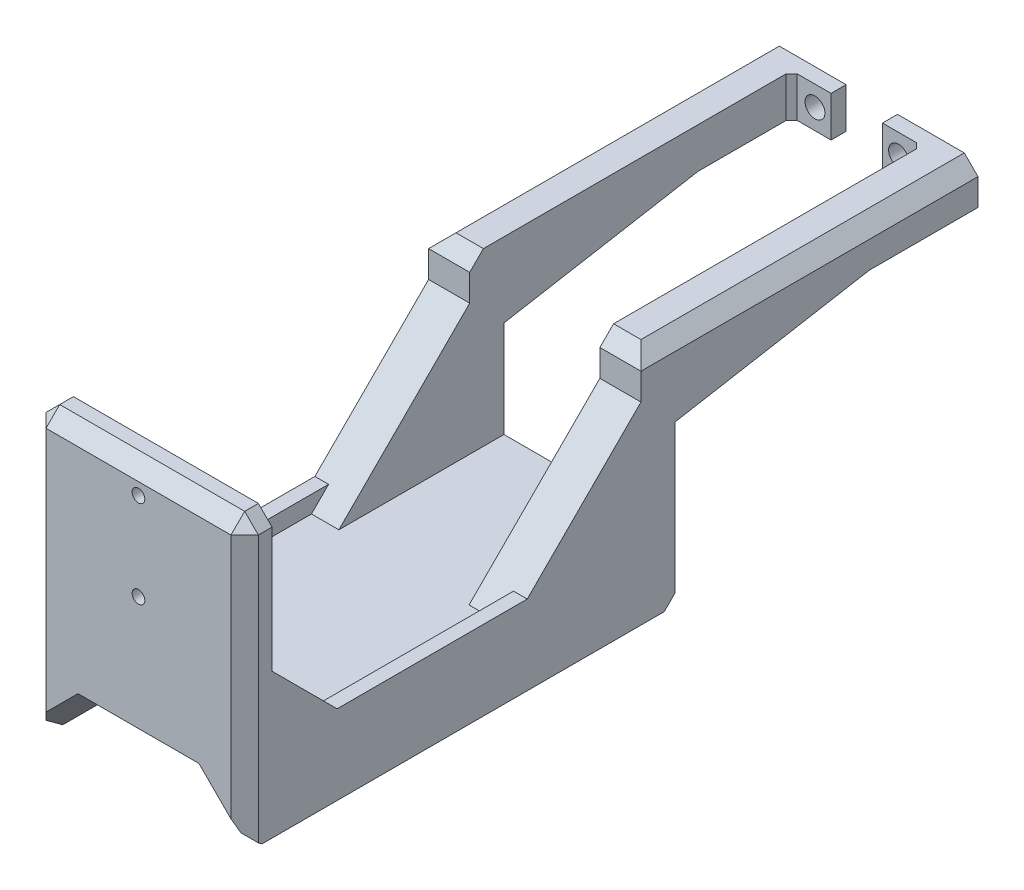
from build123d import *

# Parameters (mm, degrees)
SKETCH1_R             = 1.45
BOSS_EXTRUDE1_DEPTH   = 2.2
BOSS_EXTRUDE1_2_DEPTH = 2.2
SKETCH8_W             = 6
SKETCH8_H             = 5.9
BOSS_EXTRUDE6_DEPTH   = 42
BOSS_EXTRUDE7_DEPTH   = 5
SKETCH10_W            = 31
SKETCH10_H            = 3
BOSS_EXTRUDE8_DEPTH   = 53.85
SKETCH11_W            = 31
SKETCH11_H            = 35.214875224
SKETCH11_R            = 0.925
BOSS_EXTRUDE9_DEPTH   = 4
CHAMFER6_SIZE         = 19.1
CHAMFER7_SIZE         = 12
CHAMFER8_SIZE         = 2
CUT_EXTRUDE2_START    = 2
CUT_EXTRUDE2_DEPTH    = 27
CHAMFER10_SIZE        = 0.8
SKETCH14_W            = 7.5
SKETCH14_H            = 5.9
CUT_EXTRUDE3_DEPTH    = 112.547893301
CHAMFER11_SIZE        = 5
CHAMFER11_SIZE2       = 28.356409098
SKETCH15_W            = 2
SKETCH15_H            = 27.75
BOSS_EXTRUDE10_DEPTH  = 2.5
BOSS_EXTRUDE11_DEPTH  = 6.5
CHAMFER12_SIZE        = 1
CHAMFER13_SIZE        = 5.5
CHAMFER14_SIZE        = 1.464101615
CHAMFER14_SIZE_2      = 2
CHAMFER15_SIZE        = 0.4


# Some blends are built 0.0001 mm under size
with BuildPart() as part:
    # Sketch1 → Boss-Extrude1 (new body)
    with BuildSketch(Plane.XY):
        Polygon((0, 0), (0, 5.9), (12.25, 5.9), (12.25, 0), (2.5, 0), align=None)
        with Locations((9.4, 2.95)):
            Circle(SKETCH1_R, mode=Mode.SUBTRACT)
    extrude(amount=BOSS_EXTRUDE1_DEPTH)



with BuildPart() as body_2:
    # Sketch1 → Boss-Extrude1 2 (new body)
    with BuildSketch(Plane.XY):
        Polygon((31, 0), (31, 5.9), (18.75, 5.9), (18.75, 0), (28.5, 0), align=None)
        with Locations((21.6, 2.95)):
            Circle(SKETCH1_R, mode=Mode.SUBTRACT)
    extrude(amount=BOSS_EXTRUDE1_2_DEPTH)


with BuildPart() as part_1:
    add(part.part)

    add(body_2.part)  # Boss-Extrude6 merges body 2
    # Sketch8 → Boss-Extrude6 (add)
    with BuildSketch(Plane.XY.offset(2.2)):
        with Locations((3, 2.95)):
            Rectangle(SKETCH8_W, SKETCH8_H)
        with Locations((28, 2.95)):
            Rectangle(SKETCH8_W, SKETCH8_H)
    extrude(amount=BOSS_EXTRUDE6_DEPTH)

    # Sketch9 → Boss-Extrude7 (add)
    with BuildSketch(Plane.XY.offset(44.2)):
        Polygon((0, 5.9), (0, -22.1), (31, -22.1), (31, 5.9), (25, 5.9), (25, -19.1), (6, -19.1), (6, 5.9), align=None)
    extrude(amount=BOSS_EXTRUDE7_DEPTH)

    # Sketch10 → Boss-Extrude8 (add)
    with BuildSketch(Plane.XY.offset(49.2)):
        with Locations((15.5, -20.6)):
            Rectangle(SKETCH10_W, SKETCH10_H)
    extrude(amount=BOSS_EXTRUDE8_DEPTH)

    # Sketch11 → Boss-Extrude9 (add)
    with BuildSketch(Plane.XY.offset(103.05)):
        with Locations((15.5, -4.492562388)):
            Rectangle(SKETCH11_W, SKETCH11_H)
        with Locations((15.5, -3.45)):
            Circle(SKETCH11_R, mode=Mode.SUBTRACT)
        with Locations(Location((15.5, 9.35, 0), (0, 0, 180))):
            Circle(SKETCH11_R, mode=Mode.SUBTRACT)
    extrude(amount=BOSS_EXTRUDE9_DEPTH)

    # Chamfer6
    chamfer6_edges = [part_1.edges().sort_by_distance(p)[0] for p in [
        (3, -19.1, 49.2),
        (28, -19.1, 49.2),
    ]]
    chamfer(chamfer6_edges, length=CHAMFER6_SIZE)

    # Chamfer7
    chamfer7_edges = [part_1.edges().sort_by_distance(p)[0] for p in [
        (15.5, -19.1, 103.05),
    ]]
    chamfer(chamfer7_edges, length=CHAMFER7_SIZE)

    # Chamfer8
    chamfer8_edges = [part_1.edges().sort_by_distance(p)[0] for p in [
        (0, -4.492562388, 107.05),
        (31, -4.492562388, 107.05),
        (15.5, 13.114875224, 107.05),
        (0, 13.114875224, 105.05),
        (31, 13.114875224, 105.05),
        (31, 5.9, 24.6),
        (3, 5.9, 49.2),
        (28, 5.9, 49.2),
        (0, 5.9, 24.6),
    ]]
    chamfer(chamfer8_edges, length=CHAMFER8_SIZE)

    # Sketch13 → Cut-Extrude2 (cut)
    with BuildSketch(Plane(origin=(0, 0, 0), x_dir=(0, 0, -1), z_dir=(1, 0, 0)).offset(CUT_EXTRUDE2_START)):
        Polygon((-103.05, -7.1), (-91.05, -19.1), (-103.05, -19.1), align=None)
    extrude(amount=CUT_EXTRUDE2_DEPTH, mode=Mode.SUBTRACT)

    # Chamfer10
    chamfer10_edges = [part_1.edges().sort_by_distance(p)[0] for p in [
        (6, 2.95, 2.2),
        (25, 2.95, 2.2),
    ]]
    chamfer(chamfer10_edges, length=CHAMFER10_SIZE)

    # Sketch14 → Cut-Extrude3 (cut, through all)
    with BuildSketch(Plane.XY.offset(2.2)):
        with Locations((15.5, 2.95)):
            Rectangle(SKETCH14_W, SKETCH14_H)
    extrude(amount=-CUT_EXTRUDE3_DEPTH, mode=Mode.SUBTRACT)

    # Chamfer11
    chamfer11_edges = [part_1.edges().sort_by_distance(p)[0] for p in [
        (3, 0, 44.2),
        (28, 0, 44.2),
    ]]
    chamfer11_side = [part_1.faces().sort_by_distance(p)[0] for p in [
        (3, -0.380711177, 44.2),
    ]]
    chamfer(chamfer11_edges, length=CHAMFER11_SIZE, length2=CHAMFER11_SIZE2, reference=chamfer11_side[0])

    # Sketch15 → Boss-Extrude10 (add)
    with BuildSketch(Plane(origin=(0, -19.1, 0), x_dir=(1, 0, 0), z_dir=(0, 1, 0))):
        with Locations((1, -79.675)):
            Rectangle(SKETCH15_W, SKETCH15_H)
        with Locations((30, -79.675)):
            Rectangle(SKETCH15_W, SKETCH15_H)
    extrude(amount=BOSS_EXTRUDE10_DEPTH)

    # Sketch16 → Boss-Extrude11 (add)
    with BuildSketch(Plane.XZ.offset(22.1)):
        Polygon((2, 107.05), (2, 44.2), (0, 44.2), (0, 105.05), align=None)
        Polygon((29, 107.05), (29, 44.2), (31, 44.2), (31, 105.05), align=None)
    extrude(amount=BOSS_EXTRUDE11_DEPTH)

    # Chamfer12
    chamfer12_edges = [part_1.edges().sort_by_distance(p)[0] for p in [
        (29, -28.6, 75.625),
        (2, -28.6, 75.625),
    ]]
    chamfer(chamfer12_edges, length=CHAMFER12_SIZE)

    # Chamfer13
    chamfer13_edges = [part_1.edges().sort_by_distance(p)[0] for p in [
        (29, -22.1, 75.625),
        (2, -22.1, 75.625),
    ]]
    chamfer(chamfer13_edges, length=CHAMFER13_SIZE - 0.0001)  # a hair under: the kernel refuses the full size

    # Chamfer14
    # the kernel refuses this chamfer: 2, 1.464101615 mm, written as the material it takes off along each edge
    with BuildSketch(Plane(origin=(32.969523731, -31.569523731, 103.080476269), x_dir=(0.44444688362373996, 0.8153930851078324, -0.37094620148409235), z_dir=(-0.5773502691896258, 0.5773502691896258, 0.5773502691896258)), Plane(origin=(4.969523731, -24.630476269, 110.019523731), x_dir=(-0.4444468836237367, 0.8153930851078325, -0.37094620148409596), z_dir=(-0.5773502691896257, -0.5773502691896258, -0.5773502691896257))) as chamfer14_piece_1:
        Polygon((CHAMFER14_SIZE * 0.998648499248, CHAMFER14_SIZE * 0.0519728307677), (CHAMFER14_SIZE_2 * 0.45431445783, CHAMFER14_SIZE_2 * 0.8908413851), (0, 0), align=None)
    extrude(amount=12.018782759, mode=Mode.SUBTRACT)
    with BuildSketch(Plane(origin=(19.86319104, -18.46309104, 107.05), x_dir=(0.7068394360706733, 0.7068394360706733, 0.027495876610589075), z_dir=(0.7071067811865476, -0.7071067811865476, 0))) as chamfer14_piece_2_section:
        Polygon((CHAMFER14_SIZE_2 * 0.999621916911, -CHAMFER14_SIZE_2 * 0.0274958766106), (-CHAMFER14_SIZE_2 * 0.0274958766106, -CHAMFER14_SIZE_2 * 0.999621916911), (0, 0), align=None)
    chamfer14_piece_2 = extrude(amount=18.064765124, mode=Mode.PRIVATE)
    chamfer14_piece_2 = split(chamfer14_piece_2, bisect_by=Plane(origin=(26.660831265, -22.1, 106.348363543), z_dir=(0, -1, 0)), keep=Keep.TOP, mode=Mode.PRIVATE)
    add(chamfer14_piece_2, mode=Mode.SUBTRACT)
    with BuildSketch(Plane(origin=(2.356534024, -22.1, 107.05), x_dir=(0, 0.9996219169112968, 0.0274958766105891), z_dir=(1, 0, 0))) as chamfer14_piece_3_section:
        Polygon((CHAMFER14_SIZE_2 * 0.999621916911, -CHAMFER14_SIZE_2 * 0.0274958766106), (-CHAMFER14_SIZE_2 * 0.0274958766106, -CHAMFER14_SIZE_2 * 0.999621916911), (0, 0), align=None)
    chamfer14_piece_3 = extrude(amount=26.286931952, mode=Mode.PRIVATE)
    chamfer14_piece_3 = split(chamfer14_piece_3, bisect_by=Plane(origin=(19.18755831, -17.78745831, 106.371913367), z_dir=(-0.7071067811865476, -0.7071067811865476, 0)), keep=Keep.TOP, mode=Mode.PRIVATE)
    chamfer14_piece_3 = split(chamfer14_piece_3, bisect_by=Plane(origin=(11.81244169, -17.78745831, 106.371913367), z_dir=(0.7071067811865476, -0.7071067811865476, 0)), keep=Keep.TOP, mode=Mode.PRIVATE)
    add(chamfer14_piece_3, mode=Mode.SUBTRACT)
    with BuildSketch(Plane(origin=(-1.63690896, -31.23680896, 107.05), x_dir=(-0.7068394360706735, 0.7068394360706735, 0.02749587661058907), z_dir=(0.7071067811865476, 0.7071067811865476, 0))) as chamfer14_piece_4_section:
        Polygon((CHAMFER14_SIZE_2 * 0.999621916911, -CHAMFER14_SIZE_2 * 0.0274958766106), (-CHAMFER14_SIZE_2 * 0.0274958766106, -CHAMFER14_SIZE_2 * 0.999621916911), (0, 0), align=None)
    chamfer14_piece_4 = extrude(amount=18.064765124, mode=Mode.PRIVATE)
    chamfer14_piece_4 = split(chamfer14_piece_4, bisect_by=Plane(origin=(-0.06712973, -22.1, 106.41381375), z_dir=(0, -1, 0)), keep=Keep.TOP, mode=Mode.PRIVATE)
    add(chamfer14_piece_4, mode=Mode.SUBTRACT)
    with BuildSketch(Plane(origin=(6.143365976, -28.6, 44.2), x_dir=(0, 0.9996219169112968, -0.027495876610585647), z_dir=(-1, 0, 0))) as chamfer14_piece_5:
        Polygon((CHAMFER14_SIZE_2 * 0.999621916911, -CHAMFER14_SIZE_2 * 0.0274958766106), (-CHAMFER14_SIZE_2 * 0.0274958766106, -CHAMFER14_SIZE_2 * 0.999621916911), (0, 0), align=None)
    extrude(amount=11.286731952, mode=Mode.SUBTRACT)
    with BuildSketch(Plane(origin=(24.856634024, -28.6, 44.2), x_dir=(0, 0.9996219169112968, -0.027495876610585647), z_dir=(1, 0, 0))) as chamfer14_piece_6:
        Polygon((CHAMFER14_SIZE_2 * 0.999621916911, CHAMFER14_SIZE_2 * 0.0274958766106), (-CHAMFER14_SIZE_2 * 0.0274958766106, CHAMFER14_SIZE_2 * 0.999621916911), (0, 0), align=None)
    extrude(amount=11.286731952, mode=Mode.SUBTRACT)
    with BuildSketch(Plane(origin=(2.356534024, -22.1, 107.05), x_dir=(0, 0.9996219169112968, 0.0274958766105891), z_dir=(1, 0, 0))) as chamfer14_piece_7a_section:
        Polygon((CHAMFER14_SIZE_2 * 0.999621916911, -CHAMFER14_SIZE_2 * 0.0274958766106), (-CHAMFER14_SIZE_2 * 0.0274958766106, -CHAMFER14_SIZE_2 * 0.999621916911), (0, 0), align=None)
    chamfer14_piece_7a = extrude(amount=26.286931952, mode=Mode.PRIVATE)
    chamfer14_piece_7a = split(chamfer14_piece_7a, bisect_by=Plane(origin=(24.258421627, -22.858321627, 106.41381375), z_dir=(0.7071067811865476, 0.7071067811865476, 0)), keep=Keep.TOP, mode=Mode.PRIVATE)
    with BuildSketch(Plane(origin=(19.86319104, -18.46309104, 107.05), x_dir=(0.7068394360706733, 0.7068394360706733, 0.027495876610589075), z_dir=(0.7071067811865476, -0.7071067811865476, 0))) as chamfer14_piece_7b_section:
        Polygon((CHAMFER14_SIZE_2 * 0.999621916911, -CHAMFER14_SIZE_2 * 0.0274958766106), (-CHAMFER14_SIZE_2 * 0.0274958766106, -CHAMFER14_SIZE_2 * 0.999621916911), (0, 0), align=None)
    chamfer14_piece_7b = extrude(amount=18.064765124, mode=Mode.PRIVATE)
    chamfer14_piece_7b = split(chamfer14_piece_7b, bisect_by=Plane(origin=(22.427671271, -22.1, 106.41381375), z_dir=(0, 1, 0)), keep=Keep.TOP, mode=Mode.PRIVATE)
    chamfer14_piece_7 = chamfer14_piece_7a & chamfer14_piece_7b
    add(chamfer14_piece_7, mode=Mode.SUBTRACT)
    with BuildSketch(Plane(origin=(2.356534024, -22.1, 107.05), x_dir=(0, 0.9996219169112968, 0.0274958766105891), z_dir=(1, 0, 0))) as chamfer14_piece_8a_section:
        Polygon((CHAMFER14_SIZE_2 * 0.999621916911, -CHAMFER14_SIZE_2 * 0.0274958766106), (-CHAMFER14_SIZE_2 * 0.0274958766106, -CHAMFER14_SIZE_2 * 0.999621916911), (0, 0), align=None)
    chamfer14_piece_8a = extrude(amount=26.286931952, mode=Mode.PRIVATE)
    chamfer14_piece_8a = split(chamfer14_piece_8a, bisect_by=Plane(origin=(6.741578373, -22.858321627, 106.41381375), z_dir=(-0.7071067811865476, 0.7071067811865476, 0)), keep=Keep.TOP, mode=Mode.PRIVATE)
    with BuildSketch(Plane(origin=(-1.63690896, -31.23680896, 107.05), x_dir=(-0.7068394360706735, 0.7068394360706735, 0.02749587661058907), z_dir=(0.7071067811865476, 0.7071067811865476, 0))) as chamfer14_piece_8b_section:
        Polygon((CHAMFER14_SIZE_2 * 0.999621916911, -CHAMFER14_SIZE_2 * 0.0274958766106), (-CHAMFER14_SIZE_2 * 0.0274958766106, -CHAMFER14_SIZE_2 * 0.999621916911), (0, 0), align=None)
    chamfer14_piece_8b = extrude(amount=18.064765124, mode=Mode.PRIVATE)
    chamfer14_piece_8b = split(chamfer14_piece_8b, bisect_by=Plane(origin=(8.572328729, -22.1, 106.41381375), z_dir=(0, 1, 0)), keep=Keep.TOP, mode=Mode.PRIVATE)
    chamfer14_piece_8 = chamfer14_piece_8a & chamfer14_piece_8b
    add(chamfer14_piece_8, mode=Mode.SUBTRACT)

    # Chamfer15
    chamfer15_edges = [part_1.edges().sort_by_distance(p)[0] for p in [
        (0, -28.6, 75.083267831),
        (31, -28.6, 75.083267831),
    ]]
    chamfer(chamfer15_edges, length=CHAMFER15_SIZE)


solid = part_1.part
